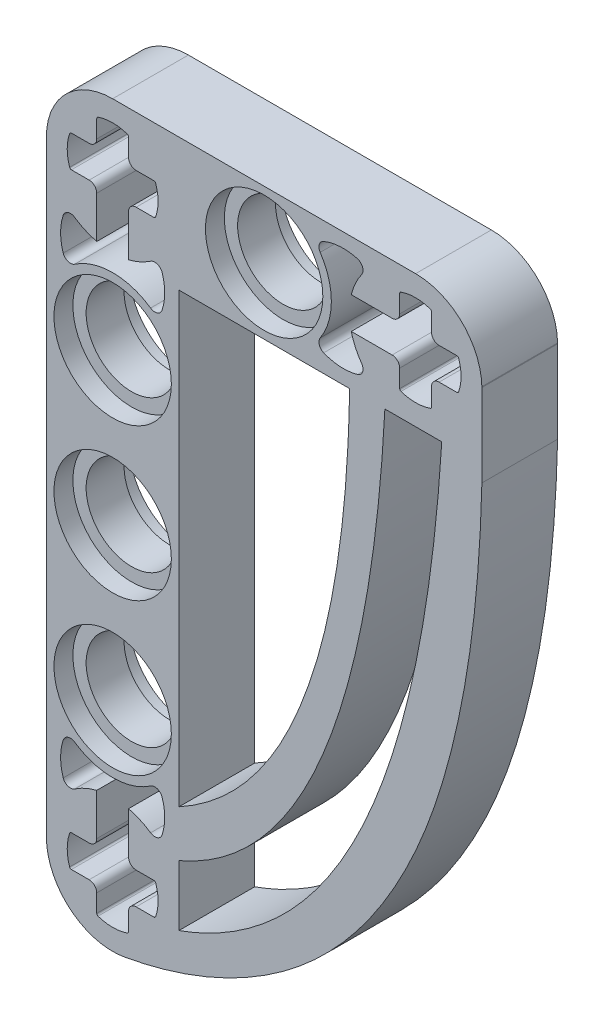
from build123d import *

# Parameters (mm, degrees)
SKETCH2_W               = 23
SKETCH2_H               = 39
BOSS_EXTRUDE1_DEPTH     = 2
SKETCH3_R               = 3.1
CUT_EXTRUDE1_DEPTH      = 1
SKETCH4_R               = 2.4
CUT_EXTRUDE2_DEPTH      = 46.453272709
LPATTERN2_COUNT         = 3
LPATTERN2_PITCH         = 8
CUT_EXTRUDE4_DEPTH      = 46.453272709
CUT_EXTRUDE5_DEPTH      = 46.453272709
SKETCH11_R              = 3.1
CUT_EXTRUDE6_DEPTH      = 1
SKETCH12_R              = 2.4
CUT_EXTRUDE7_DEPTH      = 46.453272709
CUT_EXTRUDE8_DEPTH      = 46.453272709
CUT_EXTRUDE9_DEPTH      = 46.453272709
SKETCH15_OUTSIDE_W      = 34.09
SKETCH15_OUTSIDE_H      = 50.09
CUT_EXTRUDE10_DEPTH     = 46.453272709
CUT_EXTRUDE11_START     = -2
CUT_EXTRUDE11_DEPTH     = 2
MIRROR1_COPY_1_SKETCH_R = 3.1
MIRROR1_COPY_1_DEPTH    = 1
MIRROR1_COPY_2_SKETCH_R = 3.1
MIRROR1_COPY_2_DEPTH    = 1
MIRROR1_COPY_3_SKETCH_R = 2.4
MIRROR1_COPY_3_DEPTH    = 46.453272709
MIRROR1_COPY_4_SKETCH_R = 2.4
MIRROR1_COPY_4_DEPTH    = 46.453272709


# Read off the part's stored shape, not the designer's step: Cut-Extrude11
with BuildPart() as part:
    # Sketch2 → Boss-Extrude1 (new, symmetric)
    with BuildSketch(Plane.XY):
        with Locations((11.5, 19.5)):
            Rectangle(SKETCH2_W, SKETCH2_H)
    extrude(amount=BOSS_EXTRUDE1_DEPTH, both=True)

    # Sketch3 → Cut-Extrude1 (cut)
    with BuildSketch(Plane.XY.offset(2)):
        with Locations((3.5, 27.5)):
            Circle(SKETCH3_R)
    cut_extrude1 = extrude(amount=-CUT_EXTRUDE1_DEPTH, mode=Mode.SUBTRACT)

    # Sketch4 → Cut-Extrude2 (cut, symmetric)
    with BuildSketch(Plane.XY.offset(2)):
        with Locations((3.5, 27.5)):
            Circle(SKETCH4_R)
    cut_extrude2 = extrude(amount=CUT_EXTRUDE2_DEPTH, both=True, mode=Mode.SUBTRACT)

    # LPattern2: Cut-Extrude1, Cut-Extrude2 ×3
    with Locations(*[(0, -i * LPATTERN2_PITCH, 0) for i in range(1, LPATTERN2_COUNT)]):
        add(cut_extrude1, mode=Mode.SUBTRACT)
        add(cut_extrude2, mode=Mode.SUBTRACT)

    # Sketch9 → Cut-Extrude4 (cut, symmetric)
    with BuildSketch(Plane.XY.offset(2)):
        with BuildLine():
            Line((4.74, 36.34), (5.677705214, 36.34))
            ThreePointArc((5.677705214, 36.34), (5.735940121, 36.321293884), (5.77238805, 36.272173913))
            ThreePointArc((5.77238805, 36.272173913), (5.9, 35.5), (5.77238805, 34.727826087))
            ThreePointArc((5.77238805, 34.727826087), (5.735940121, 34.678706116), (5.677705214, 34.66))
            Line((5.677705214, 34.66), (4.74, 34.66))
            ThreePointArc((4.74, 34.66), (4.457157288, 34.542842712), (4.34, 34.26))
            Line((4.34, 34.26), (4.34, 33.322294786))
            ThreePointArc((4.34, 33.322294786), (4.321293884, 33.264059879), (4.272173913, 33.22761195))
            ThreePointArc((4.272173913, 33.22761195), (3.5, 33.1), (2.727826087, 33.22761195))
            ThreePointArc((2.727826087, 33.22761195), (2.678706116, 33.264059879), (2.66, 33.322294786))
            Line((2.66, 33.322294786), (2.66, 34.26))
            ThreePointArc((2.66, 34.26), (2.542842712, 34.542842712), (2.26, 34.66))
            Line((2.26, 34.66), (1.322294786, 34.66))
            ThreePointArc((1.322294786, 34.66), (1.264059879, 34.678706116), (1.22761195, 34.727826087))
            ThreePointArc((1.22761195, 34.727826087), (1.1, 35.5), (1.22761195, 36.272173913))
            ThreePointArc((1.22761195, 36.272173913), (1.264059879, 36.321293884), (1.322294786, 36.34))
            Line((1.322294786, 36.34), (2.26, 36.34))
            ThreePointArc((2.26, 36.34), (2.542842712, 36.457157288), (2.66, 36.74))
            Line((2.66, 36.74), (2.66, 37.677705214))
            ThreePointArc((2.66, 37.677705214), (2.678706116, 37.735940121), (2.727826087, 37.77238805))
            ThreePointArc((2.727826087, 37.77238805), (3.5, 37.9), (4.272173913, 37.77238805))
            ThreePointArc((4.272173913, 37.77238805), (4.321293884, 37.735940121), (4.34, 37.677705214))
            Line((4.34, 37.677705214), (4.34, 36.74))
            ThreePointArc((4.34, 36.74), (4.457157288, 36.457157288), (4.74, 36.34))
        make_face()
    cut_extrude4 = extrude(amount=CUT_EXTRUDE4_DEPTH, both=True, mode=Mode.SUBTRACT)

    # Sketch10 → Cut-Extrude5 (cut, symmetric)
    with BuildSketch(Plane.XY.offset(2)):
        with BuildLine():
            Line((2.66, 33.322294786), (2.66, 32.05081169))
            ThreePointArc((2.66, 32.05081169), (2.054202258, 32.257752494), (1.495419806, 32.570126582))
            ThreePointArc((1.495419806, 32.570126582), (1.141748912, 32.619033599), (0.889900826, 32.365957447))
            ThreePointArc((0.889900826, 32.365957447), (0.75, 31.5), (0.889900826, 30.634042553))
            ThreePointArc((0.889900826, 30.634042553), (1.141748912, 30.380966401), (1.495419806, 30.429873418))
            ThreePointArc((1.495419806, 30.429873418), (3.5, 31.05), (5.504580194, 30.429873418))
            ThreePointArc((5.504580194, 30.429873418), (5.858251088, 30.380966401), (6.110099174, 30.634042553))
            ThreePointArc((6.110099174, 30.634042553), (6.25, 31.5), (6.110099174, 32.365957447))
            ThreePointArc((6.110099174, 32.365957447), (5.858251088, 32.619033599), (5.504580194, 32.570126582))
            ThreePointArc((5.504580194, 32.570126582), (4.945797742, 32.257752494), (4.34, 32.05081169))
            Line((4.34, 32.05081169), (4.34, 33.322294786))
            Line((4.34, 33.322294786), (2.66, 33.322294786))
        make_face()
    cut_extrude5 = extrude(amount=CUT_EXTRUDE5_DEPTH, both=True, mode=Mode.SUBTRACT)

    # Sketch11 → Cut-Extrude6 (cut)
    with BuildSketch(Plane.XY.offset(2)):
        with Locations((11.5, 35.5)):
            Circle(SKETCH11_R)
    cut_extrude6 = extrude(amount=-CUT_EXTRUDE6_DEPTH, mode=Mode.SUBTRACT)

    # Sketch12 → Cut-Extrude7 (cut, symmetric)
    with BuildSketch(Plane.XY.offset(2)):
        with Locations((11.5, 35.5)):
            Circle(SKETCH12_R)
    cut_extrude7 = extrude(amount=CUT_EXTRUDE7_DEPTH, both=True, mode=Mode.SUBTRACT)

    # Sketch13 → Cut-Extrude8 (cut, symmetric)
    with BuildSketch(Plane.XY.offset(2)):
        with BuildLine():
            Line((20.34, 36.74), (20.34, 37.677705214))
            ThreePointArc((20.34, 37.677705214), (20.321293884, 37.735940121), (20.272173913, 37.77238805))
            ThreePointArc((20.272173913, 37.77238805), (19.5, 37.9), (18.727826087, 37.77238805))
            ThreePointArc((18.727826087, 37.77238805), (18.678706116, 37.735940121), (18.66, 37.677705214))
            Line((18.66, 37.677705214), (18.66, 36.74))
            ThreePointArc((18.66, 36.74), (18.542842712, 36.457157288), (18.26, 36.34))
            Line((18.26, 36.34), (17.322294786, 36.34))
            Line((17.322294786, 36.34), (16.102294892, 36.34))
            ThreePointArc((16.102294892, 36.34), (16.319098144, 36.960090198), (16.647951067, 37.528747615))
            ThreePointArc((16.647951067, 37.528747615), (16.699384014, 37.893206453), (16.431279659, 38.145388227))
            ThreePointArc((16.431279659, 38.145388227), (15.530106146, 38.24591184), (14.645229563, 38.047891313))
            ThreePointArc((14.645229563, 38.047891313), (14.413678121, 37.795726592), (14.461995639, 37.456803984))
            ThreePointArc((14.461995639, 37.456803984), (15.05, 35.5), (14.461995639, 33.543196016))
            ThreePointArc((14.461995639, 33.543196016), (14.413678121, 33.204273408), (14.645229563, 32.952108687))
            ThreePointArc((14.645229563, 32.952108687), (15.530106146, 32.75408816), (16.431279659, 32.854611773))
            ThreePointArc((16.431279659, 32.854611773), (16.699384014, 33.106793547), (16.647951067, 33.471252385))
            ThreePointArc((16.647951067, 33.471252385), (16.319098144, 34.039909802), (16.102294892, 34.66))
            Line((16.102294892, 34.66), (17.322294786, 34.66))
            Line((17.322294786, 34.66), (18.26, 34.66))
            ThreePointArc((18.26, 34.66), (18.542842712, 34.542842712), (18.66, 34.26))
            Line((18.66, 34.26), (18.66, 33.322294786))
            ThreePointArc((18.66, 33.322294786), (18.678706116, 33.264059879), (18.727826087, 33.22761195))
            ThreePointArc((18.727826087, 33.22761195), (19.5, 33.1), (20.272173913, 33.22761195))
            ThreePointArc((20.272173913, 33.22761195), (20.321293884, 33.264059879), (20.34, 33.322294786))
            Line((20.34, 33.322294786), (20.34, 34.26))
            ThreePointArc((20.34, 34.26), (20.457157288, 34.542842712), (20.74, 34.66))
            Line((20.74, 34.66), (21.677705214, 34.66))
            ThreePointArc((21.677705214, 34.66), (21.735940121, 34.678706116), (21.77238805, 34.727826087))
            ThreePointArc((21.77238805, 34.727826087), (21.9, 35.5), (21.77238805, 36.272173913))
            ThreePointArc((21.77238805, 36.272173913), (21.735940121, 36.321293884), (21.677705214, 36.34))
            Line((21.677705214, 36.34), (20.74, 36.34))
            ThreePointArc((20.74, 36.34), (20.457157288, 36.457157288), (20.34, 36.74))
        make_face()
    cut_extrude8 = extrude(amount=CUT_EXTRUDE8_DEPTH, both=True, mode=Mode.SUBTRACT)

    # Sketch14 → Cut-Extrude9 (cut, symmetric)
    with BuildSketch(Plane.XY.offset(2)):
        with BuildLine():
            Line((4.74, 4.34), (5.677705214, 4.34))
            ThreePointArc((5.677705214, 4.34), (5.735940121, 4.321293884), (5.77238805, 4.272173913))
            ThreePointArc((5.77238805, 4.272173913), (5.9, 3.5), (5.77238805, 2.727826087))
            ThreePointArc((5.77238805, 2.727826087), (5.735940121, 2.678706116), (5.677705214, 2.66))
            Line((5.677705214, 2.66), (4.74, 2.66))
            ThreePointArc((4.74, 2.66), (4.457157288, 2.542842712), (4.34, 2.26))
            Line((4.34, 2.26), (4.34, 1.322294786))
            ThreePointArc((4.34, 1.322294786), (4.321293884, 1.264059879), (4.272173913, 1.22761195))
            ThreePointArc((4.272173913, 1.22761195), (3.5, 1.1), (2.727826087, 1.22761195))
            ThreePointArc((2.727826087, 1.22761195), (2.678706116, 1.264059879), (2.66, 1.322294786))
            Line((2.66, 1.322294786), (2.66, 2.26))
            ThreePointArc((2.66, 2.26), (2.542842712, 2.542842712), (2.26, 2.66))
            Line((2.26, 2.66), (1.322294786, 2.66))
            ThreePointArc((1.322294786, 2.66), (1.264059879, 2.678706116), (1.22761195, 2.727826087))
            ThreePointArc((1.22761195, 2.727826087), (1.1, 3.5), (1.22761195, 4.272173913))
            ThreePointArc((1.22761195, 4.272173913), (1.264059879, 4.321293884), (1.322294786, 4.34))
            Line((1.322294786, 4.34), (2.26, 4.34))
            ThreePointArc((2.26, 4.34), (2.542842712, 4.457157288), (2.66, 4.74))
            Line((2.66, 4.74), (2.66, 5.748199279))
            Line((2.66, 5.748199279), (2.66, 6.94918831))
            ThreePointArc((2.66, 6.94918831), (2.054202258, 6.742247506), (1.495419806, 6.429873418))
            ThreePointArc((1.495419806, 6.429873418), (1.141748912, 6.380966401), (0.889900826, 6.634042553))
            ThreePointArc((0.889900826, 6.634042553), (0.75, 7.5), (0.889900826, 8.365957447))
            ThreePointArc((0.889900826, 8.365957447), (1.141748912, 8.619033599), (1.495419806, 8.570126582))
            ThreePointArc((1.495419806, 8.570126582), (3.5, 7.95), (5.504580194, 8.570126582))
            ThreePointArc((5.504580194, 8.570126582), (5.858251088, 8.619033599), (6.110099174, 8.365957447))
            ThreePointArc((6.110099174, 8.365957447), (6.25, 7.5), (6.110099174, 6.634042553))
            ThreePointArc((6.110099174, 6.634042553), (5.858251088, 6.380966401), (5.504580194, 6.429873418))
            ThreePointArc((5.504580194, 6.429873418), (4.945797742, 6.742247506), (4.34, 6.94918831))
            Line((4.34, 6.94918831), (4.34, 5.748199279))
            Line((4.34, 5.748199279), (4.34, 4.74))
            ThreePointArc((4.34, 4.74), (4.457157288, 4.457157288), (4.74, 4.34))
        make_face()
    cut_extrude9 = extrude(amount=CUT_EXTRUDE9_DEPTH, both=True, mode=Mode.SUBTRACT)

    # Sketch15 outside → Cut-Extrude10 (cut, symmetric)
    # profile 1 of 2: a face of its own
    with BuildSketch(Plane.XY.offset(2)):
        with Locations((11.5, 19.5)):
            Rectangle(SKETCH15_OUTSIDE_W, SKETCH15_OUTSIDE_H)
        with BuildLine():
            Line((0, 3.5), (0, 35.5))
            ThreePointArc((0, 35.5), (1.025126266, 37.974873734), (3.5, 39))
            Line((3.5, 39), (19.5, 39))
            ThreePointArc((19.5, 39), (21.94653583, 38.002890815), (22.999092604, 35.579692818))
            add(Edge.make_bspline(
                [(22.999092604, 35.579692818), (23.130073693, 29.967281663), (22.107077993, 20.40040153), (19.712496377, 12.430329612), (16.39192477, 7.15072211), (12.975632719, 3.757926199), (7.825550409, 0.72452511), (4.132498883, 0.057625069)],
                knots=[0, 0, 0, 0.164969589, 0.329939178, 0.494908767, 0.604888492, 0.714868218, 0.879837807, 0.879837807, 0.879837807], degree=2))
            ThreePointArc((4.132498883, 0.057625069), (1.259882379, 0.810785794), (0, 3.5))
        make_face(mode=Mode.SUBTRACT)
    # profile 2 of 2: a face of its own
    with BuildSketch(Plane.XY.offset(2)):
        with BuildLine():
            Line((6.99999999, 8.365767663), (6.99999999, 31.999988928))
            Line((6.99999999, 31.999988928), (16.014561131, 31.999988928))
            add(Edge.make_bspline(
                [(16.014561131, 31.999988928), (16.007958847, 31.586391834), (15.923298784, 28.389251571), (15.199166456, 21.68238799), (13.217184336, 15.226240151), (10.861277081, 11.516725652), (8.653986927, 9.335595923), (7.183105055, 8.465422525), (6.99999999, 8.365767663)],
                knots=[0.055627331, 0.055627331, 0.055627331, 0.069534164, 0.164969589, 0.329939178, 0.494908767, 0.604888492, 0.714868218, 0.730003237, 0.730003237, 0.730003237], degree=2))
        make_face()
    cut_extrude10 = extrude(amount=CUT_EXTRUDE10_DEPTH, both=True, mode=Mode.SUBTRACT)

    # Cut-Extrude11 outline → Cut-Extrude11 (cut)
    with BuildSketch(Plane.XY.offset(2).offset(CUT_EXTRUDE11_START)):
        with BuildLine():
            add(Edge.make_bspline(
                [(20.876642016, 31.923629686), (20.845129326, 31.425625375), (20.774245689, 30.421376198), (20.607605177, 28.484677736), (20.34945778, 26.149971938), (19.960274256, 23.500728313), (19.334065086, 20.16536296), (18.347807831, 16.366235051), (16.827290212, 12.393931211), (14.951056705, 9.008370101), (11.952145602, 5.292348579), (9.103609335, 3.454358573), (6.99999999, 2.706055916)],
                knots=[0.045361119, 0.045361119, 0.045361119, 0.045361119, 0.06502479, 0.08468846, 0.124015802, 0.163343143, 0.202670485, 0.281325168, 0.35997985, 0.438634533, 0.517289216, 0.674598582, 0.674598582, 0.674598582, 0.674598582], degree=3))
            Line((20.876642016, 31.923629686), (20.876642016, 31.999988928))
            Line((20.876642016, 31.999988928), (17.87660955, 31.999988965))
            add(Edge.make_bspline(
                [(17.87660955, 31.999988965), (17.85318748, 31.54744238), (17.798199303, 30.610126143), (17.663432355, 28.78189136), (17.444804063, 26.555870425), (17.107222543, 24.045353759), (16.557584148, 20.907496285), (15.686447141, 17.382283483), (14.357781948, 13.791407248), (12.763943958, 10.840329741), (10.440430678, 7.908451391), (8.438875311, 6.519157563), (6.99999999, 5.907584623)],
                knots=[0.046408625, 0.046408625, 0.046408625, 0.046408625, 0.06502479, 0.08468846, 0.124015802, 0.163343143, 0.202670485, 0.281325168, 0.35997985, 0.438634533, 0.517289216, 0.657878569, 0.657878569, 0.657878569, 0.657878569], degree=3))
            Line((6.99999999, 5.907584623), (6.99999999, 2.706055916))
        make_face()
    cut_extrude11 = extrude(amount=CUT_EXTRUDE11_DEPTH, mode=Mode.SUBTRACT)

    # Mirror1: Cut-Extrude1, Cut-Extrude2, Cut-Extrude4, Cut-Extrude5, Cut-Extrude6, Cut-Extrude7, Cut-Extrude8, Cut-Extrude9, Cut-Extrude10, Cut-Extrude11 across plane
    add(cut_extrude1.mirror(Plane.XY), mode=Mode.SUBTRACT)
    add(cut_extrude2.mirror(Plane.XY), mode=Mode.SUBTRACT)
    add(cut_extrude4.mirror(Plane.XY), mode=Mode.SUBTRACT)
    add(cut_extrude5.mirror(Plane.XY), mode=Mode.SUBTRACT)
    add(cut_extrude6.mirror(Plane.XY), mode=Mode.SUBTRACT)
    add(cut_extrude7.mirror(Plane.XY), mode=Mode.SUBTRACT)
    add(cut_extrude8.mirror(Plane.XY), mode=Mode.SUBTRACT)
    add(cut_extrude9.mirror(Plane.XY), mode=Mode.SUBTRACT)
    add(cut_extrude10.mirror(Plane.XY), mode=Mode.SUBTRACT)
    add(cut_extrude11.mirror(Plane.XY), mode=Mode.SUBTRACT)

    # Mirror1 copy 1 sketch → Mirror1 copy 1 (cut)
    with BuildSketch(Plane(origin=(0, -8, -2), x_dir=(1, 0, 0), z_dir=(0, 0, -1))):
        with Locations((3.5, -27.5)):
            Circle(MIRROR1_COPY_1_SKETCH_R)
    extrude(amount=-MIRROR1_COPY_1_DEPTH, mode=Mode.SUBTRACT)

    # Mirror1 copy 2 sketch → Mirror1 copy 2 (cut)
    with BuildSketch(Plane(origin=(0, -16, -2), x_dir=(1, 0, 0), z_dir=(0, 0, -1))):
        with Locations((3.5, -27.5)):
            Circle(MIRROR1_COPY_2_SKETCH_R)
    extrude(amount=-MIRROR1_COPY_2_DEPTH, mode=Mode.SUBTRACT)

    # Mirror1 copy 3 sketch → Mirror1 copy 3 (cut, symmetric)
    with BuildSketch(Plane(origin=(0, -8, -2), x_dir=(1, 0, 0), z_dir=(0, 0, -1))):
        with Locations((3.5, -27.5)):
            Circle(MIRROR1_COPY_3_SKETCH_R)
    extrude(amount=MIRROR1_COPY_3_DEPTH, both=True, mode=Mode.SUBTRACT)

    # Mirror1 copy 4 sketch → Mirror1 copy 4 (cut, symmetric)
    with BuildSketch(Plane(origin=(0, -16, -2), x_dir=(1, 0, 0), z_dir=(0, 0, -1))):
        with Locations((3.5, -27.5)):
            Circle(MIRROR1_COPY_4_SKETCH_R)
    extrude(amount=MIRROR1_COPY_4_DEPTH, both=True, mode=Mode.SUBTRACT)


solid = part.part
